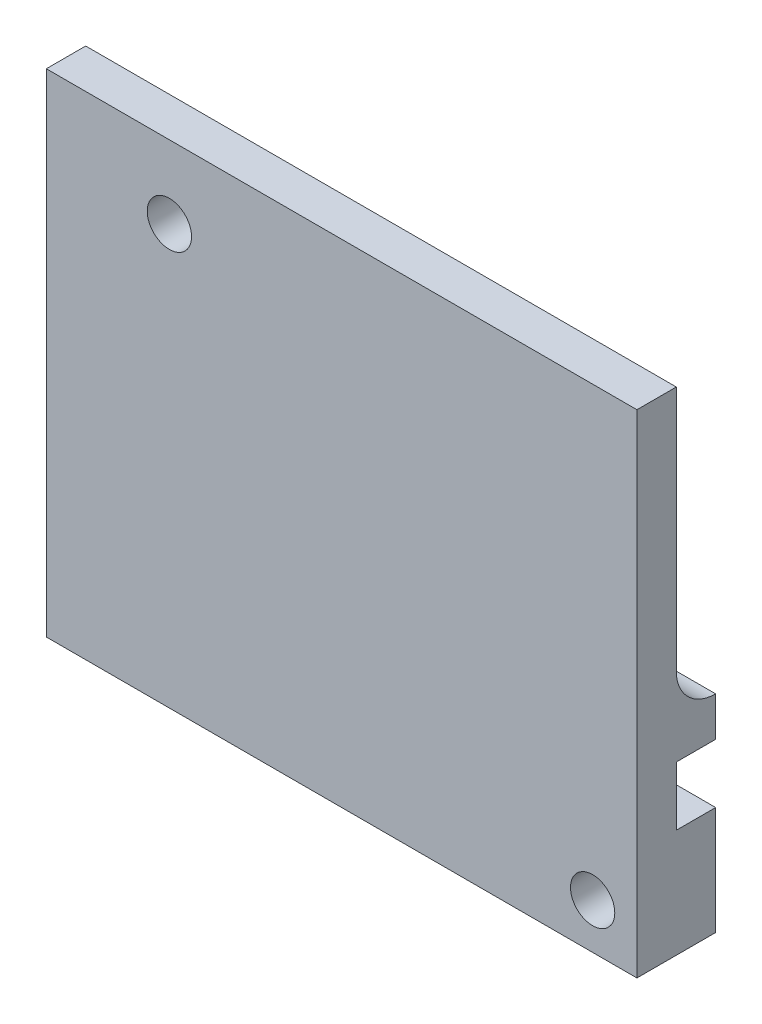
from build123d import *

# Parameters (mm, degrees)
SKETCH1_W           = 60
SKETCH1_H           = 50
BOSS_EXTRUDE1_DEPTH = 4
SKETCH2_W           = 60
SKETCH2_H           = 4
BOSS_EXTRUDE2_DEPTH = 4
FILLET1_R           = 4
BOSS_EXTRUDE3_DEPTH = 4
SKETCH3_R           = 2.25
CUT_EXTRUDE1_DEPTH  = 79.511145706


with BuildPart() as part:
    # Sketch1 → Boss-Extrude1 (new body)
    with BuildSketch(Plane.XY):
        with Locations((30, 25)):
            Rectangle(SKETCH1_W, SKETCH1_H)
    extrude(amount=BOSS_EXTRUDE1_DEPTH)

    # Sketch2 → Boss-Extrude2 (add)
    with BuildSketch(Plane(origin=(0, 0, 0), x_dir=(-1, 0, 0), z_dir=(0, 0, -1))):
        with Locations((-30, 19)):
            Rectangle(SKETCH2_W, SKETCH2_H)
    extrude(amount=BOSS_EXTRUDE2_DEPTH)

    # Fillet1
    fillet1_edges = [part.edges().sort_by_distance(p)[0] for p in [
        (30, 21, 0),
    ]]
    fillet(fillet1_edges, radius=FILLET1_R - 0.0001)  # a hair under: the kernel refuses the full size

    # Sketch6 → Boss-Extrude3 (add)
    with BuildSketch(Plane(origin=(0, 0, 0), x_dir=(-1, 0, 0), z_dir=(0, 0, -1))):
        with BuildLine():
            Line((0, 0), (0, 11))
            Line((0, 11), (-21, 11))
            ThreePointArc((-21, 11), (-25.242640687, 9.242640687), (-27, 5))
            Line((-27, 5), (-27, 0))
            Line((-27, 0), (0, 0))
        make_face()
        with BuildLine():
            Line((-33, 5), (-33, 0))
            Line((-33, 0), (-60, 0))
            Line((-60, 0), (-60, 11))
            Line((-60, 11), (-39, 11))
            ThreePointArc((-39, 11), (-34.757359313, 9.242640687), (-33, 5))
        make_face()
    extrude(amount=BOSS_EXTRUDE3_DEPTH)

    # Sketch3 → Cut-Extrude1 (cut, through all)
    with BuildSketch(Plane.XY.offset(4)):
        with Locations((12.5, 42.6)):
            Circle(SKETCH3_R)
        with Locations((55.5, 4.6)):
            Circle(SKETCH3_R)
    extrude(amount=-CUT_EXTRUDE1_DEPTH, mode=Mode.SUBTRACT)


solid = part.part
